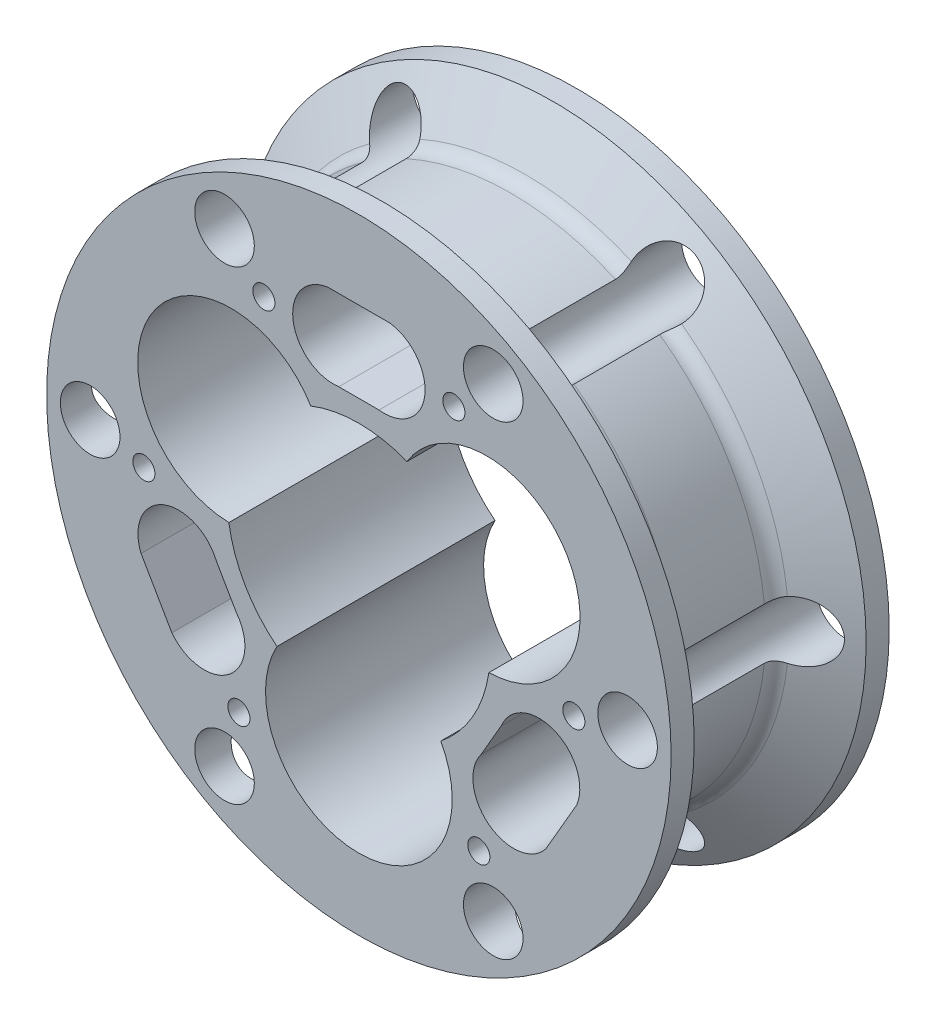
from build123d import *

# Parameters (mm, degrees)
CUT_EXTRUDE1_DEPTH     = 68.805329737
CUT_EXTRUDE2_DEPTH     = 68.805329737
CUT_EXTRUDE3_DEPTH     = 68.80532974
M33_CLEARANCE_HOLE1_D  = 36.195
M2_5_CLEARANCE_HOLE1_D = 3.048
M22_CLEARANCE_HOLE1_D  = 25.7048
M22_CLEARANCE_HOLE2_D  = 25.704800008
HOLE1_D                = 8.2042
M2_5_CLEARANCE_HOLE2_D = 3.048
FILLET1_R              = 2.362200014


with BuildPart() as part:
    # Sketch1 → Revolve1 (revolve)
    with BuildSketch(Plane(origin=(0, 0, 0), x_dir=(1, 0, 0), z_dir=(0, 1, 0))):
        Polygon((42.989499996, 30.022800008), (-4e-09, 30.022800008), (-4e-09, 8e-09), (42.989499996, 8e-09), (42.989499996, 3.175000008), (35.0774, 7.743053055), (35.0774, 22.279746945), (42.989499996, 26.847800008), align=None)
    revolve(axis=Axis((-4e-09, 0, -30.022800008), (0, 0, 1)))

    # Sketch2 → Cut-Extrude1 (cut, through all)
    with BuildSketch(Plane(origin=(0, 0, -30.022800008), x_dir=(-1, 0, 0), z_dir=(0, 0, -1))):
        with BuildLine():
            Line((4.236814217, 32.18180002), (-4.23681421, 32.18180002))
            ThreePointArc((-4.23681421, 32.18180002), (-9.064327166, 25.890462841), (-2.772989892, 21.062950008))
            Line((-2.772989892, 21.062950008), (2.772989892, 21.062950008))
            ThreePointArc((2.772989892, 21.062950008), (9.06432706, 25.890462852), (4.236814217, 32.18180002))
        make_face()
    extrude(amount=-CUT_EXTRUDE1_DEPTH, mode=Mode.SUBTRACT)

    # Sketch3 → Cut-Extrude2 (cut, through all)
    with BuildSketch(Plane(origin=(0, 0, -30.022800008), x_dir=(-1, 0, 0), z_dir=(0, 0, -1))):
        with BuildLine():
            Line((25.751849186, -19.760088821), (29.988663444, -12.421711264))
            ThreePointArc((29.988663444, -12.421711264), (26.953962122, -5.095293915), (19.627544773, -8.129995238))
            Line((19.627544773, -8.129995238), (16.854554747, -12.932954852))
            ThreePointArc((16.854554747, -12.932954852), (17.889634995, -20.795169039), (25.751849186, -19.760088821))
        make_face()
    extrude(amount=-CUT_EXTRUDE2_DEPTH, mode=Mode.SUBTRACT)

    # Sketch4 → Cut-Extrude3 (cut, through all)
    with BuildSketch(Plane.XY):
        with BuildLine():
            Line((19.627544724, -8.129995322), (16.854554796, -12.932954767))
            ThreePointArc((16.854554796, -12.932954767), (17.889634913, -20.795168996), (25.751849144, -19.760088906))
            Line((25.751849144, -19.760088906), (29.988663498, -12.421711183))
            ThreePointArc((29.988663498, -12.421711183), (26.953962042, -5.095293865), (19.627544724, -8.129995322))
        make_face()
    extrude(amount=-CUT_EXTRUDE3_DEPTH, mode=Mode.SUBTRACT)

    # M33 Clearance Hole1 (through all)
    with Locations(Plane.XY):
        with Locations((0, 0)):
            Hole(M33_CLEARANCE_HOLE1_D / 2)

    # M2.5 Clearance Hole1 (through all)
    with Locations(Plane(origin=(0, 0, -30.022800008), x_dir=(-1, 0, 0), z_dir=(0, 0, -1))):
        with Locations((-29.59626735, -1.982511224)):
            Hole(M2_5_CLEARANCE_HOLE1_D / 2)

    # M22 Clearance Hole1 (through all)
    with Locations(Plane(origin=(0, 0, -30.022800008), x_dir=(-1, 0, 0), z_dir=(0, 0, -1))):
        with Locations((0, -20.32), (-17.597636204, 10.16)):
            Hole(M22_CLEARANCE_HOLE1_D / 2)

    # M22 Clearance Hole2 (through all)
    with Locations(Plane.XY):
        with Locations((-17.597636204, 10.16)):
            Hole(M22_CLEARANCE_HOLE2_D / 2)

    # Hole1 (through all)
    with Locations(Plane.XY):
        with Locations((18.49755, -32.038696425), (-18.49755, -32.038696425), (-36.9951, 0), (-18.49755, 32.038696425), (18.49755, 32.038696425), (36.9951, 0)):
            Hole(HOLE1_D / 2)

    # M2.5 Clearance Hole2 (through all)
    with Locations(Plane.XY):
        with Locations((16.515038776, -24.639863776), (-16.515038776, -24.639863776), (-29.59626735, -1.982511224), (-13.081228575, 26.622375), (13.081228575, 26.622375)):
            Hole(M2_5_CLEARANCE_HOLE2_D / 2)

    # Fillet1
    # the kernel refuses this fillet: 2.362200014 mm, written as the material it adds along each edge
    with BuildSketch(Plane(origin=(-4e-09, 0, -7.743053055), x_dir=(0.4969710336835583, 0.8677671298680859, 0), z_dir=(0.8677671298680859, -0.4969710336835583, 0))) as fillet1_piece_1_section:
        with BuildLine():
            CenterArc((35.077400004 + FILLET1_R, -FILLET1_R * 0.577350270157), FILLET1_R, 119.999999918, 60.000000082)
            Line((35.077400004, -FILLET1_R * 0.577350270157), (35.077400004, 0))
            Line((35.077400004, 0), (35.077400004 + FILLET1_R * 0.500000001248, FILLET1_R * 0.288675134367))
        make_face()
    fillet1_piece_1 = revolve(axis=Axis((-4e-09, 0, -7.743053055), (0, 0, 1)), revolution_arc=59.599613418, mode=Mode.PRIVATE)
    fillet1_piece_1 = fillet1_piece_1 - Plane(origin=(-18.49755, 32.038696425, -7.914083199), x_dir=(-1, 0, 0), z_dir=(0, 0, -1)) * Cylinder(4.1021, 146, mode=Mode.PRIVATE)
    fillet1_piece_1 = fillet1_piece_1 - Plane(origin=(18.49755, 32.038696425, -7.914083199), x_dir=(-1, 0, 0), z_dir=(0, 0, -1)) * Cylinder(4.1021, 146, mode=Mode.PRIVATE)
    add(fillet1_piece_1)
    with BuildSketch(Plane(origin=(-4e-09, 0, -7.743053055), x_dir=(0.9999938958764059, 0.003494024889442384, 0), z_dir=(0.003494024889442384, -0.9999938958764059, 0))) as fillet1_piece_2_section:
        with BuildLine():
            CenterArc((35.077400004 + FILLET1_R, -FILLET1_R * 0.577350270157), FILLET1_R, 119.999999918, 60.000000082)
            Line((35.077400004, -FILLET1_R * 0.577350270157), (35.077400004, 0))
            Line((35.077400004, 0), (35.077400004 + FILLET1_R * 0.500000001248, FILLET1_R * 0.288675134367))
        make_face()
    fillet1_piece_2 = revolve(axis=Axis((-4e-09, 0, -7.743053055), (0, 0, 1)), revolution_arc=59.599613433, mode=Mode.PRIVATE)
    fillet1_piece_2 = fillet1_piece_2 - Plane(origin=(36.9951, 0, -7.914083199), x_dir=(-1, 0, 0), z_dir=(0, 0, -1)) * Cylinder(4.1021, 146, mode=Mode.PRIVATE)
    fillet1_piece_2 = fillet1_piece_2 - Plane(origin=(18.49755, 32.038696425, -7.914083199), x_dir=(-1, 0, 0), z_dir=(0, 0, -1)) * Cylinder(4.1021, 146, mode=Mode.PRIVATE)
    add(fillet1_piece_2)
    with BuildSketch(Plane(origin=(-4e-09, 0, -22.279746945), x_dir=(0.5030228622856749, -0.8642731049951322, 0), z_dir=(-0.8642731049951322, -0.5030228622856749, 0))) as fillet1_piece_3_section:
        with BuildLine():
            CenterArc((35.077400004 + FILLET1_R, FILLET1_R * 0.577350269208), FILLET1_R, 180, 60)
            Line((35.077400004, FILLET1_R * 0.577350269208), (35.077400004, 0))
            Line((35.077400004, 0), (35.077400004 + FILLET1_R * 0.500000000016, -FILLET1_R * 0.288675134604))
        make_face()
    fillet1_piece_3 = revolve(axis=Axis((-4e-09, 0, -22.279746945), (0, 0, 1)), revolution_arc=59.599613415, mode=Mode.PRIVATE)
    fillet1_piece_3 = fillet1_piece_3 - Plane(origin=(18.49755, -32.038696425, -22.108716802), x_dir=(-1, 0, 0), z_dir=(0, 0, -1)) * Cylinder(4.1021, 146, mode=Mode.PRIVATE)
    fillet1_piece_3 = fillet1_piece_3 - Plane(origin=(36.9951, 0, -22.108716802), x_dir=(-1, 0, 0), z_dir=(0, 0, -1)) * Cylinder(4.1021, 146, mode=Mode.PRIVATE)
    add(fillet1_piece_3)
    with BuildSketch(Plane(origin=(-4e-09, 0, -22.279746945), x_dir=(0.4969710335449245, 0.8677671299474817, 0), z_dir=(0.8677671299474817, -0.4969710335449245, 0))) as fillet1_piece_4_section:
        with BuildLine():
            CenterArc((35.077400004 + FILLET1_R, FILLET1_R * 0.577350269208), FILLET1_R, 180, 60)
            Line((35.077400004, FILLET1_R * 0.577350269208), (35.077400004, 0))
            Line((35.077400004, 0), (35.077400004 + FILLET1_R * 0.500000000016, -FILLET1_R * 0.288675134604))
        make_face()
    fillet1_piece_4 = revolve(axis=Axis((-4e-09, 0, -22.279746945), (0, 0, 1)), revolution_arc=59.5996134, mode=Mode.PRIVATE)
    fillet1_piece_4 = fillet1_piece_4 - Plane(origin=(-18.49755, 32.038696425, -22.108716802), x_dir=(-1, 0, 0), z_dir=(0, 0, -1)) * Cylinder(4.1021, 146, mode=Mode.PRIVATE)
    fillet1_piece_4 = fillet1_piece_4 - Plane(origin=(18.49755, 32.038696425, -22.108716802), x_dir=(-1, 0, 0), z_dir=(0, 0, -1)) * Cylinder(4.1021, 146, mode=Mode.PRIVATE)
    add(fillet1_piece_4)
    with BuildSketch(Plane(origin=(-4e-09, 0, -7.743053055), x_dir=(-0.5030228620323829, 0.8642731051425528, 0), z_dir=(0.8642731051425528, 0.5030228620323829, 0))) as fillet1_piece_5_section:
        with BuildLine():
            CenterArc((35.077400004 + FILLET1_R, -FILLET1_R * 0.577350270157), FILLET1_R, 119.999999918, 60.000000082)
            Line((35.077400004, -FILLET1_R * 0.577350270157), (35.077400004, 0))
            Line((35.077400004, 0), (35.077400004 + FILLET1_R * 0.500000001248, FILLET1_R * 0.288675134367))
        make_face()
    fillet1_piece_5 = revolve(axis=Axis((-4e-09, 0, -7.743053055), (0, 0, 1)), revolution_arc=59.599613433, mode=Mode.PRIVATE)
    fillet1_piece_5 = fillet1_piece_5 - Plane(origin=(-36.9951, 0, -7.914083199), x_dir=(-1, 0, 0), z_dir=(0, 0, -1)) * Cylinder(4.1021, 146, mode=Mode.PRIVATE)
    fillet1_piece_5 = fillet1_piece_5 - Plane(origin=(-18.49755, 32.038696425, -7.914083199), x_dir=(-1, 0, 0), z_dir=(0, 0, -1)) * Cylinder(4.1021, 146, mode=Mode.PRIVATE)
    add(fillet1_piece_5)
    with BuildSketch(Plane(origin=(-4e-09, 0, -7.743053055), x_dir=(-0.4969710334470595, -0.867767130003529, 0), z_dir=(-0.867767130003529, 0.4969710334470595, 0))) as fillet1_piece_6_section:
        with BuildLine():
            CenterArc((35.077400004 + FILLET1_R, -FILLET1_R * 0.577350270157), FILLET1_R, 119.999999918, 60.000000082)
            Line((35.077400004 + FILLET1_R * 0.500000001248, FILLET1_R * 0.288675134367), (35.077400004, 0))
            Line((35.077400004, 0), (35.077400004, -FILLET1_R * 0.577350270157))
        make_face()
    fillet1_piece_6 = revolve(axis=Axis((-4e-09, 0, -7.743053055), (0, 0, 1)), revolution_arc=59.599613418, mode=Mode.PRIVATE)
    fillet1_piece_6 = fillet1_piece_6 - Plane(origin=(-18.49755, -32.038696425, -7.914083194), x_dir=(-1, 0, 0), z_dir=(0, 0, -1)) * Cylinder(4.1021, 146, mode=Mode.PRIVATE)
    fillet1_piece_6 = fillet1_piece_6 - Plane(origin=(18.49755, -32.038696425, -7.914083194), x_dir=(-1, 0, 0), z_dir=(0, 0, -1)) * Cylinder(4.1021, 146, mode=Mode.PRIVATE)
    add(fillet1_piece_6)
    with BuildSketch(Plane(origin=(-4e-09, 0, -7.743053055), x_dir=(0.5030228621475993, -0.8642731050754948, 0), z_dir=(-0.8642731050754948, -0.5030228621475993, 0))) as fillet1_piece_7_section:
        with BuildLine():
            CenterArc((35.077400004 + FILLET1_R, -FILLET1_R * 0.577350270157), FILLET1_R, 119.999999918, 60.000000082)
            Line((35.077400004, -FILLET1_R * 0.577350270157), (35.077400004, 0))
            Line((35.077400004, 0), (35.077400004 + FILLET1_R * 0.500000001248, FILLET1_R * 0.288675134367))
        make_face()
    fillet1_piece_7 = revolve(axis=Axis((-4e-09, 0, -7.743053055), (0, 0, 1)), revolution_arc=59.599613433, mode=Mode.PRIVATE)
    fillet1_piece_7 = fillet1_piece_7 - Plane(origin=(18.49755, -32.038696425, -7.914083199), x_dir=(-1, 0, 0), z_dir=(0, 0, -1)) * Cylinder(4.1021, 146, mode=Mode.PRIVATE)
    fillet1_piece_7 = fillet1_piece_7 - Plane(origin=(36.9951, 0, -7.914083199), x_dir=(-1, 0, 0), z_dir=(0, 0, -1)) * Cylinder(4.1021, 146, mode=Mode.PRIVATE)
    add(fillet1_piece_7)
    with BuildSketch(Plane(origin=(-4e-09, 0, -22.279746945), x_dir=(-0.9999938958753612, -0.003494025188429562, 0), z_dir=(-0.003494025188429562, 0.9999938958753612, 0))) as fillet1_piece_8_section:
        with BuildLine():
            CenterArc((35.077400004 + FILLET1_R, FILLET1_R * 0.577350269208), FILLET1_R, 180, 60)
            Line((35.077400004, FILLET1_R * 0.577350269208), (35.077400004, 0))
            Line((35.077400004, 0), (35.077400004 + FILLET1_R * 0.500000000016, -FILLET1_R * 0.288675134604))
        make_face()
    fillet1_piece_8 = revolve(axis=Axis((-4e-09, 0, -22.279746945), (0, 0, 1)), revolution_arc=59.599613414, mode=Mode.PRIVATE)
    fillet1_piece_8 = fillet1_piece_8 - Plane(origin=(-18.49755, -32.038696425, -22.108716801), x_dir=(-1, 0, 0), z_dir=(0, 0, -1)) * Cylinder(4.1021, 146, mode=Mode.PRIVATE)
    fillet1_piece_8 = fillet1_piece_8 - Plane(origin=(-36.9951, 0, -22.108716801), x_dir=(-1, 0, 0), z_dir=(0, 0, -1)) * Cylinder(4.1021, 146, mode=Mode.PRIVATE)
    add(fillet1_piece_8)
    with BuildSketch(Plane(origin=(-4e-09, 0, -22.279746945), x_dir=(0.9999938958758475, 0.003494025049200698, 0), z_dir=(0.003494025049200698, -0.9999938958758475, 0))) as fillet1_piece_9_section:
        with BuildLine():
            CenterArc((35.077400004 + FILLET1_R, FILLET1_R * 0.577350269208), FILLET1_R, 180, 60)
            Line((35.077400004, FILLET1_R * 0.577350269208), (35.077400004, 0))
            Line((35.077400004, 0), (35.077400004 + FILLET1_R * 0.500000000016, -FILLET1_R * 0.288675134604))
        make_face()
    fillet1_piece_9 = revolve(axis=Axis((-4e-09, 0, -22.279746945), (0, 0, 1)), revolution_arc=59.599613415, mode=Mode.PRIVATE)
    fillet1_piece_9 = fillet1_piece_9 - Plane(origin=(36.9951, 0, -22.108716801), x_dir=(-1, 0, 0), z_dir=(0, 0, -1)) * Cylinder(4.1021, 146, mode=Mode.PRIVATE)
    fillet1_piece_9 = fillet1_piece_9 - Plane(origin=(18.49755, 32.038696425, -22.108716801), x_dir=(-1, 0, 0), z_dir=(0, 0, -1)) * Cylinder(4.1021, 146, mode=Mode.PRIVATE)
    add(fillet1_piece_9)
    with BuildSketch(Plane(origin=(-4e-09, 0, -7.743053055), x_dir=(-0.9999938958759192, -0.003494025028670776, 0), z_dir=(-0.003494025028670776, 0.9999938958759192, 0))) as fillet1_piece_10_section:
        with BuildLine():
            CenterArc((35.077400004 + FILLET1_R, -FILLET1_R * 0.577350270157), FILLET1_R, 119.999999918, 60.000000082)
            Line((35.077400004, -FILLET1_R * 0.577350270157), (35.077400004, 0))
            Line((35.077400004, 0), (35.077400004 + FILLET1_R * 0.500000001248, FILLET1_R * 0.288675134367))
        make_face()
    fillet1_piece_10 = revolve(axis=Axis((-4e-09, 0, -7.743053055), (0, 0, 1)), revolution_arc=59.599613433, mode=Mode.PRIVATE)
    fillet1_piece_10 = fillet1_piece_10 - Plane(origin=(-18.49755, -32.038696425, -7.914083199), x_dir=(-1, 0, 0), z_dir=(0, 0, -1)) * Cylinder(4.1021, 146, mode=Mode.PRIVATE)
    fillet1_piece_10 = fillet1_piece_10 - Plane(origin=(-36.9951, 0, -7.914083199), x_dir=(-1, 0, 0), z_dir=(0, 0, -1)) * Cylinder(4.1021, 146, mode=Mode.PRIVATE)
    add(fillet1_piece_10)
    with BuildSketch(Plane(origin=(-4e-09, 0, -22.279746945), x_dir=(-0.49697103330842485, -0.8677671300829253, 0), z_dir=(-0.8677671300829253, 0.49697103330842485, 0))) as fillet1_piece_11_section:
        with BuildLine():
            CenterArc((35.077400004 + FILLET1_R, FILLET1_R * 0.577350269208), FILLET1_R, 180, 60)
            Line((35.077400004, FILLET1_R * 0.577350269208), (35.077400004, 0))
            Line((35.077400004, 0), (35.077400004 + FILLET1_R * 0.500000000016, -FILLET1_R * 0.288675134604))
        make_face()
    fillet1_piece_11 = revolve(axis=Axis((-4e-09, 0, -22.279746945), (0, 0, 1)), revolution_arc=59.5996134, mode=Mode.PRIVATE)
    fillet1_piece_11 = fillet1_piece_11 - Plane(origin=(-18.49755, -32.038696425, -22.108716806), x_dir=(-1, 0, 0), z_dir=(0, 0, -1)) * Cylinder(4.1021, 146, mode=Mode.PRIVATE)
    fillet1_piece_11 = fillet1_piece_11 - Plane(origin=(18.49755, -32.038696425, -22.108716806), x_dir=(-1, 0, 0), z_dir=(0, 0, -1)) * Cylinder(4.1021, 146, mode=Mode.PRIVATE)
    add(fillet1_piece_11)
    with BuildSketch(Plane(origin=(-4e-09, 0, -22.279746945), x_dir=(-0.5030228621704586, 0.8642731050621903, 0), z_dir=(0.8642731050621903, 0.5030228621704586, 0))) as fillet1_piece_12_section:
        with BuildLine():
            CenterArc((35.077400004 + FILLET1_R, FILLET1_R * 0.577350269208), FILLET1_R, 180, 60)
            Line((35.077400004, FILLET1_R * 0.577350269208), (35.077400004, 0))
            Line((35.077400004, 0), (35.077400004 + FILLET1_R * 0.500000000016, -FILLET1_R * 0.288675134604))
        make_face()
    fillet1_piece_12 = revolve(axis=Axis((-4e-09, 0, -22.279746945), (0, 0, 1)), revolution_arc=59.599613414, mode=Mode.PRIVATE)
    fillet1_piece_12 = fillet1_piece_12 - Plane(origin=(-36.9951, 0, -22.108716801), x_dir=(-1, 0, 0), z_dir=(0, 0, -1)) * Cylinder(4.1021, 146, mode=Mode.PRIVATE)
    fillet1_piece_12 = fillet1_piece_12 - Plane(origin=(-18.49755, 32.038696425, -22.108716801), x_dir=(-1, 0, 0), z_dir=(0, 0, -1)) * Cylinder(4.1021, 146, mode=Mode.PRIVATE)
    add(fillet1_piece_12)


solid = part.part
